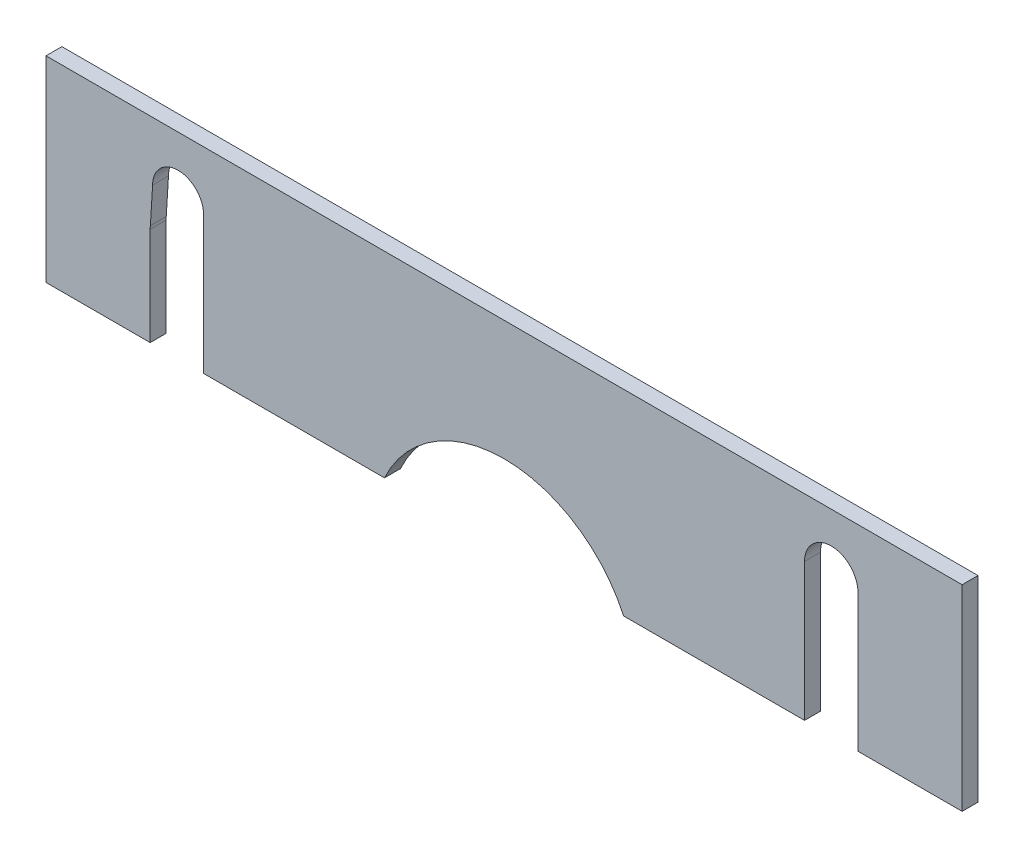
from build123d import *

# Parameters (mm, degrees)
SKETCH1_W          = 70
SKETCH1_H          = 15
SKETCH1_R          = 2.04
BASE_FLANGE1_DEPTH = 1.21412
SKETCH3_R          = 10.067909511
CUT_EXTRUDE1_DEPTH = 10
CUT_EXTRUDE2_DEPTH = 10


# Sheet-metal steps are written as plain solids
with BuildPart() as part:
    # Sketch1 → Base-Flange1 (new body)
    with BuildSketch(Plane.XY):
        Rectangle(SKETCH1_W, SKETCH1_H)
        with Locations((-25, 0)):
            Circle(SKETCH1_R, mode=Mode.SUBTRACT)
        with Locations((25, 0)):
            Circle(SKETCH1_R, mode=Mode.SUBTRACT)
    extrude(amount=-BASE_FLANGE1_DEPTH)

    # Sketch3 → Cut-Extrude1 (cut)
    with BuildSketch(Plane.XY):
        with Locations((0, -11.728394917)):
            Circle(SKETCH3_R)
    extrude(amount=-CUT_EXTRUDE1_DEPTH, mode=Mode.SUBTRACT)

    # Sketch4 → Cut-Extrude2 (cut)
    with BuildSketch(Plane(origin=(0, 0, -1.21412), x_dir=(-1, 0, 0), z_dir=(0, 0, -1))):
        with BuildLine():
            Line((27.04, 0), (27.04, -7.5))
            Line((27.04, -7.5), (22.96, -7.5))
            Line((22.96, -7.5), (22.96, 0))
            Line((22.96, 0), (22.96, 3.022234101))
            ThreePointArc((22.96, 3.022234101), (24.907398497, 4.969632598), (26.854796994, 3.022234101))
            Line((26.854796994, 3.022234101), (27.04, 0))
        make_face()
        with BuildLine():
            Line((-22.96, 0), (-22.96, -7.5))
            Line((-22.96, -7.5), (-27.04, -7.5))
            Line((-27.04, -7.5), (-27.04, 0))
            Line((-27.04, 0), (-27.04, 3.022234101))
            ThreePointArc((-27.04, 3.022234101), (-25, 5.062234101), (-22.96, 3.022234101))
            Line((-22.96, 3.022234101), (-22.96, 0))
        make_face()
    extrude(amount=-CUT_EXTRUDE2_DEPTH, mode=Mode.SUBTRACT)


solid = part.part
